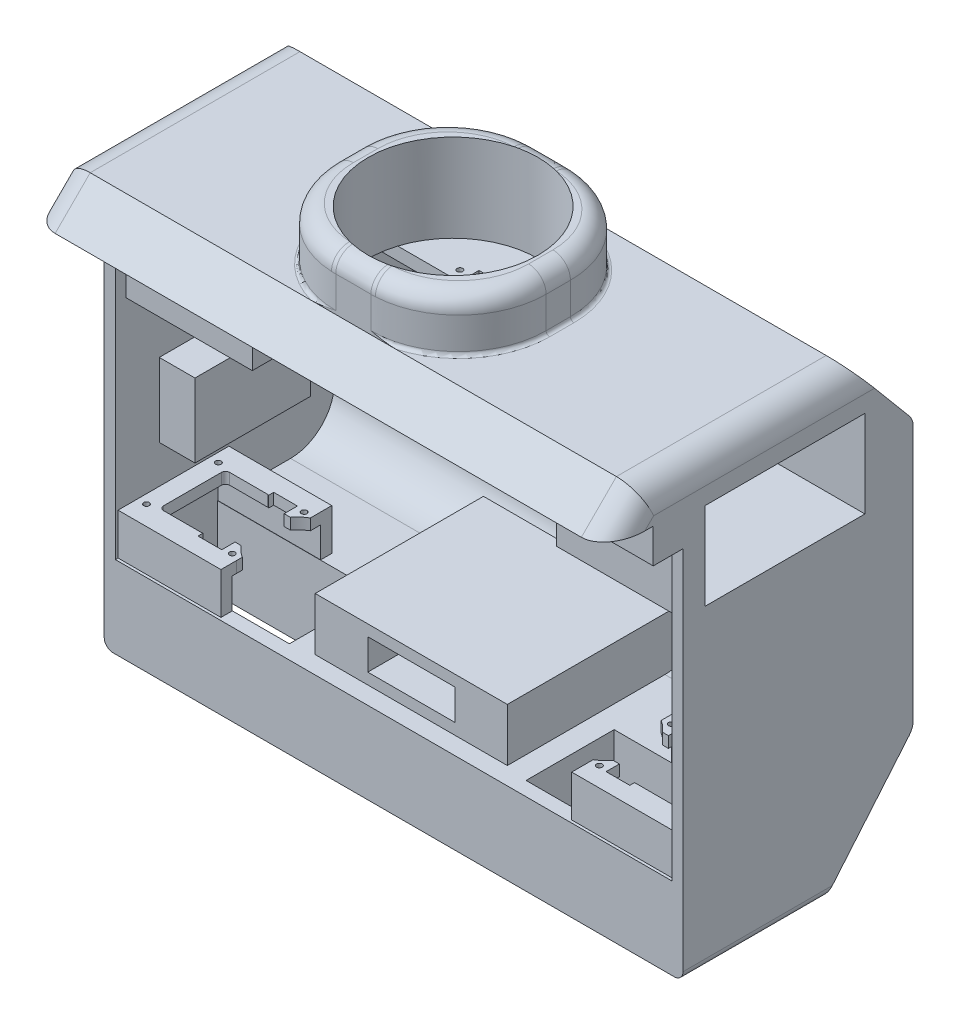
from build123d import *

# Parameters (mm, degrees)
SKETCH1_W               = 165.1
SKETCH1_H               = 54
BOSS_EXTRUDE1_DEPTH     = 6.35
BOSS_EXTRUDE2_DEPTH     = 165.1
SKETCH7_W               = 3.175
SKETCH7_H               = 90
BOSS_EXTRUDE3_DEPTH     = 62.482691454
BOSS_EXTRUDE4_DEPTH     = 1
CUT_EXTRUDE2_DEPTH      = 193.510277918
CUT_EXTRUDE2_DEPTH_BACK = 193.510277918
SKETCH10_W              = 60
SKETCH10_H              = 47.65
BOSS_EXTRUDE6_DEPTH     = 3.175
SKETCH15_W              = 45.62
SKETCH15_H              = 25.12
CUT_EXTRUDE3_DEPTH      = 10
SKETCH16_W              = 165.1
SKETCH16_H              = 65.657691454
SKETCH16_W_2            = 45.62
SKETCH16_H_2            = 25.12
BOSS_EXTRUDE7_DEPTH     = 17
CHAMFER2_SIZE           = 4
CHAMFER2_SIZE2          = 3.356398525
CHAMFER3_SIZE           = 30
CHAMFER3_SIZE2          = 25.172988935
FILLET1_R               = 12.5
FILLET2_R               = 5
CHAMFER5_SIZE           = 3.175
CHAMFER6_SIZE           = 3.175
BOSS_EXTRUDE9_DEPTH     = 20.535
BOSS_EXTRUDE10_REACH    = 145.635
CUT_EXTRUDE4_DEPTH      = 20
SKETCH25_R              = 24.2
SKETCH25_R_2            = 4.327955779
BOSS_EXTRUDE11_DEPTH    = 10
CHAMFER9_SIZE2          = 8.390996312
CHAMFER9_SIZE           = 10
SKETCH26_W              = 60
SKETCH26_H              = 56.936490272
SKETCH26_R              = 24.2
BOSS_EXTRUDE12_DEPTH    = 15
BOSS_EXTRUDE13_DEPTH    = 3.5
FILLET6_R               = 25
FILLET7_R               = 5
SKETCH28_W              = 35.968101279
SKETCH28_H              = 45.615895688
CUT_EXTRUDE5_DEPTH      = 7.5
SKETCH29_W              = 35.968101279
SKETCH29_H              = 45.615895688
CUT_EXTRUDE6_DEPTH      = 7.5
FILLET8_R               = 7.5
FILLET9_R               = 2.5
SKETCH31_W              = 5.585601369
SKETCH31_H              = 21.2
CUT_EXTRUDE7_DEPTH      = 10
SKETCH30_R              = 0.8
BOSS_EXTRUDE14_DEPTH    = 7.08
SKETCH33_W              = 12
SKETCH33_H              = 51.965895688
CUT_EXTRUDE9_DEPTH      = 7.5
CHAMFER12_SIZE          = 7.5
BOSS_EXTRUDE15_DEPTH    = 3.175
SKETCH37_W              = 32.793101279
SKETCH37_H              = 45.615895688
BOSS_EXTRUDE16_DEPTH    = 3.175
SKETCH42_R              = 0.8
CUT_EXTRUDE10_DEPTH     = 8
BOSS_EXTRUDE17_DEPTH    = 3.175
SKETCH41_W              = 29.34851345
SKETCH41_H              = 3.175
SKETCH41_W_2            = 29.348515031
BOSS_EXTRUDE19_DEPTH    = 8.65
SKETCH43_W              = 54.81
SKETCH43_H              = 44.952691454
SKETCH43_H_2            = 3.047308546
BOSS_EXTRUDE20_DEPTH    = 15.1
FILLET11_R              = 1
FILLET12_R              = 5
BOSS_EXTRUDE21_REACH    = 213.049
FILLET13_START          = 36
FILLET13_DEPTH          = 17
SKETCH45_W              = 24.81
SKETCH45_H              = 8.75
CUT_EXTRUDE11_DEPTH     = 48
SKETCH46_W              = 33.002691454
SKETCH46_H              = 21
BOSS_EXTRUDE22_DEPTH    = 10.18
SKETCH47_R              = 0.799606177
SKETCH47_R_2            = 0.796689263
BOSS_EXTRUDE24_DEPTH    = 3.7


with BuildPart() as part:
    # Sketch1 → Boss-Extrude1 (new body)
    with BuildSketch(Plane(origin=(0, 0, 0), x_dir=(1, 0, 0), z_dir=(0, 1, 0))):
        with Locations((0, 1.6)):
            Rectangle(SKETCH1_W, SKETCH1_H)
    extrude(amount=BOSS_EXTRUDE1_DEPTH)

    # Sketch6 → Boss-Extrude2 (add)
    with BuildSketch(Plane.ZY.offset(82.55)):
        Polygon((-37.082691454, 90), (-37.082691454, 6.35), (-28.6, 6.35), (-28.6, 0), (-40.257691454, 0), (-40.257691454, 90), align=None)
    extrude(amount=-BOSS_EXTRUDE2_DEPTH)

    # Sketch7 → Boss-Extrude3 (add)
    with BuildSketch(Plane.XY.offset(25.4)):
        with Locations((-80.9625, 45)):
            Rectangle(SKETCH7_W, SKETCH7_H)
        with Locations((80.9625, 45)):
            Rectangle(SKETCH7_W, SKETCH7_H)
    extrude(amount=-BOSS_EXTRUDE3_DEPTH)

    # Sketch9 → Boss-Extrude4 (add)
    with BuildSketch(Plane(origin=(0, 0, -40.257691454), x_dir=(-1, 0, 0), z_dir=(0, 0, -1))):
        with BuildLine():
            Line((-65.55, 83), (65.55, 83))
            ThreePointArc((65.55, 83), (66.964213562, 82.414213562), (67.55, 81))
            Line((67.55, 81), (67.55, 32))
            ThreePointArc((67.55, 32), (66.964213562, 30.585786438), (65.55, 30))
            Line((65.55, 30), (-65.55, 30))
            ThreePointArc((-65.55, 30), (-66.964213562, 30.585786438), (-67.55, 32))
            Line((-67.55, 32), (-67.55, 81))
            ThreePointArc((-67.55, 81), (-66.964213562, 82.414213562), (-65.55, 83))
        make_face()
    extrude(amount=BOSS_EXTRUDE4_DEPTH)

    # Sketch10 → Cut-Extrude2 (cut, two sides: drawn at the far end of the back side and taken through both)
    with BuildSketch(Plane.ZY.offset(82.55).offset(-CUT_EXTRUDE2_DEPTH_BACK)):
        with Locations((-4.6, 66.175)):
            Rectangle(SKETCH10_W, SKETCH10_H)
    extrude(amount=CUT_EXTRUDE2_DEPTH + CUT_EXTRUDE2_DEPTH_BACK, mode=Mode.SUBTRACT)

    # Sketch12 → Boss-Extrude6 (add)
    with BuildSketch(Plane(origin=(0, 90, 0), x_dir=(1, 0, 0), z_dir=(0, 1, 0))):
        Polygon((-82.55, -25.4), (-82.55, -30.4), (82.55, -30.4), (82.55, -25.4), (82.55, 40.257691454), (-82.55, 40.257691454), align=None)
    extrude(amount=BOSS_EXTRUDE6_DEPTH)

    # Sketch15 → Cut-Extrude3 (cut)
    with BuildSketch(Plane.XZ):
        with Locations((-56.565, 8.821154273)):
            Rectangle(SKETCH15_W, SKETCH15_H)
        with Locations((56.565, 8.821154273)):
            Rectangle(SKETCH15_W, SKETCH15_H)
    extrude(amount=-CUT_EXTRUDE3_DEPTH, mode=Mode.SUBTRACT)

    # Sketch16 → Boss-Extrude7 (add)
    with BuildSketch(Plane.XZ):
        with Locations((0, -7.428845727)):
            Rectangle(SKETCH16_W, SKETCH16_H)
        with Locations((-56.565, 8.821154273)):
            Rectangle(SKETCH16_W_2, SKETCH16_H_2, mode=Mode.SUBTRACT)
        with Locations((56.565, 8.821154273)):
            Rectangle(SKETCH16_W_2, SKETCH16_H_2, mode=Mode.SUBTRACT)
    extrude(amount=BOSS_EXTRUDE7_DEPTH)

    # Chamfer2
    chamfer2_edges = [part.edges().sort_by_distance(p)[0] for p in [
        (0, 93.175, -40.257691454),
    ]]
    chamfer2_side = [part.faces().sort_by_distance(p)[0] for p in [
        (0, 26.143741279, -40.257691454),
    ]]
    chamfer(chamfer2_edges, length=CHAMFER2_SIZE, length2=CHAMFER2_SIZE2, reference=chamfer2_side[0])

    # Chamfer3
    chamfer3_edges = [part.edges().sort_by_distance(p)[0] for p in [
        (0, -17, -40.257691454),
    ]]
    chamfer3_side = [part.faces().sort_by_distance(p)[0] for p in [
        (0, 22.003358437, -40.257691454),
    ]]
    chamfer(chamfer3_edges, length=CHAMFER3_SIZE, length2=CHAMFER3_SIZE2, reference=chamfer3_side[0])

    # Fillet1
    fillet1_edges = [part.edges().sort_by_distance(p)[0] for p in [
        (0, 6.35, -37.082691454),
    ]]
    fillet(fillet1_edges, radius=FILLET1_R)

    # Fillet2
    fillet2_edges = [part.edges().sort_by_distance(p)[0] for p in [
        (0, 13, -40.257691454),
    ]]
    fillet(fillet2_edges, radius=FILLET2_R)

    # Chamfer5
    chamfer5_edges = [part.edges().sort_by_distance(p)[0] for p in [
        (-80.9625, 90, -34.6),
        (80.9625, 90, -34.6),
    ]]
    chamfer(chamfer5_edges, length=CHAMFER5_SIZE)

    # Chamfer6
    chamfer6_edges = [part.edges().sort_by_distance(p)[0] for p in [
        (-80.9625, 42.35, -34.6),
        (80.9625, 42.35, -34.6),
    ]]
    chamfer(chamfer6_edges, length=CHAMFER6_SIZE)

    # Sketch18 → Boss-Extrude9 (add)
    with BuildSketch(Plane(origin=(0, 93.175, 0), x_dir=(1, 0, 0), z_dir=(0, 1, 0))):
        Polygon((-46.581898721, -19.129674968), (-82.55, -19.129674968), (-82.55, -22.304674968), (-43.406898721, -22.304674968), (-43.406898721, 29.66122072), (-82.55, 29.66122072), (-82.55, 26.48622072), (-46.581898721, 26.48622072), align=None)
    boss_extrude9 = extrude(amount=-BOSS_EXTRUDE9_DEPTH)

    # Mirror1: Boss-Extrude9 across plane
    add(boss_extrude9.mirror(Plane(origin=(0, 0, 0), x_dir=(0, 0, 1), z_dir=(1, 0, 0))))

    # Boss-Extrude10: up to this plane
    boss_extrude10_end = Plane(origin=(0, 93.175, -36.901292929), z_dir=(0, 0.642787609686539, -0.7660444431189783))
    # Sketch20 → Boss-Extrude10 (add, up to the surface)
    with BuildSketch(Plane.XY.offset(30.4), mode=Mode.PRIVATE) as boss_extrude10_sk1:
        Polygon((-52.55, 99.825839879), (52.55, 99.825839879), (82.55, 99.825839879), (82.55, 93.175), (-82.55, 93.175), (-82.55, 99.825839879), align=None)
    boss_extrude10_tool1 = split(extrude(boss_extrude10_sk1.sketch, amount=-BOSS_EXTRUDE10_REACH, mode=Mode.PRIVATE), bisect_by=boss_extrude10_end, keep=Keep.BOTH, mode=Mode.PRIVATE)
    add(boss_extrude10_tool1.solids().sort_by_distance((0, 96.50042, 30.4))[0])

    # Sketch23 → Cut-Extrude4 (cut)
    with BuildSketch(Plane(origin=(0, 99.825839879, 0), x_dir=(1, 0, 0), z_dir=(0, 1, 0))):
        with BuildLine():
            Line((8.384417448, -20.561333056), (9.877394556, -19.068355948))
            ThreePointArc((9.877394556, -19.068355948), (10.188277859, -18.689544742), (10.419285151, -18.257361923))
            ThreePointArc((10.419285151, -18.257361923), (10.561538197, -17.788414636), (10.609570503, -17.300725817))
            Line((10.609570503, -17.300725817), (10.609570503, 0.433707386))
            ThreePointArc((10.609570503, 0.433707386), (10.561538223, 0.921395053), (10.419285642, 1.39034128))
            ThreePointArc((10.419285642, 1.39034128), (10.188277932, 1.822525176), (9.877393834, 2.201337214))
            Line((9.877393834, 2.201337214), (8.384416723, 3.694314325))
            ThreePointArc((8.384416723, 3.694314325), (8.005605517, 4.005197628), (7.573422697, 4.23620492))
            ThreePointArc((7.573422697, 4.23620492), (7.104475411, 4.378457966), (6.616786591, 4.426490271))
            Line((6.616786591, 4.426490271), (-33.110604264, 4.426490271))
            ThreePointArc((-33.110604264, 4.426490271), (-34.87827006, 3.694345107), (-35.610429497, 1.926685224))
            Line((-35.610429497, 1.926685224), (-35.610429497, -18.793692999))
            ThreePointArc((-35.610429497, -18.793692999), (-35.420160735, -19.750343242), (-34.878277155, -20.561357469))
            ThreePointArc((-34.878277155, -20.561357469), (-34.067268353, -21.103238753), (-33.110624449, -21.293509728))
            Line((-33.110624449, -21.293509728), (6.616786596, -21.293509728))
            ThreePointArc((6.616786596, -21.293509728), (7.104474783, -21.245477548), (7.573421511, -21.103224868))
            ThreePointArc((7.573421511, -21.103224868), (8.005605409, -20.872217156), (8.384417448, -20.561333056))
        make_face()
    extrude(amount=-CUT_EXTRUDE4_DEPTH, mode=Mode.SUBTRACT)

    # Sketch25 → Boss-Extrude11 (add)
    # profile 1 of 2: a face of its own
    with BuildSketch(Plane(origin=(0, 99.825839879, 0), x_dir=(1, 0, 0), z_dir=(0, 1, 0))):
        Polygon((-82.55, -30.4), (-82.55, 31.320575639), (82.55, 31.320575639), (82.55, -30.4), (82.55, -36.9), (-82.55, -36.9), align=None)
        with Locations(Location((-0.000429497, -8.433509728, 0), (0, 0, 147.89956854))):
            Circle(SKETCH25_R, mode=Mode.SUBTRACT)
    # profile 2 of 2: a face of its own
    with BuildSketch(Plane(origin=(0, 99.825839879, 0), x_dir=(1, 0, 0), z_dir=(0, 1, 0))):
        with Locations((-0.000429497, -8.433509728)):
            Circle(SKETCH25_R_2)
    extrude(amount=BOSS_EXTRUDE11_DEPTH)


with BuildPart() as boss_extrude11_kept_piece:
    # of the separate pieces the step leaves, the one the design keeps (boss_extrude11_pieces_kept)
    add(part.part.solids().sort_by_distance((-82.55, 45.525, -34.6))[0])

    # Chamfer9
    chamfer9_edges = [boss_extrude11_kept_piece.edges().sort_by_distance(p)[0] for p in [
        (0, 109.825839879, -31.320575639),
    ]]
    chamfer9_side = [boss_extrude11_kept_piece.faces().sort_by_distance(p)[0] for p in [
        (0, 109.658019953, -31.320575639),
    ]]
    chamfer(chamfer9_edges, length=CHAMFER9_SIZE - 0.0001, length2=CHAMFER9_SIZE2 - 0.0001, reference=chamfer9_side[0])  # a hair under: the kernel refuses the full size

    # Sketch26 → Boss-Extrude12 (add)
    with BuildSketch(Plane(origin=(0, 109.825839879, 0), x_dir=(1, 0, 0), z_dir=(0, 1, 0))):
        with Locations((-0.000429497, -8.431754864)):
            Rectangle(SKETCH26_W, SKETCH26_H)
        with Locations(Location((-0.000429497, -8.433509728, 0), (0, 0, 147.89956854))):
            Circle(SKETCH26_R, mode=Mode.SUBTRACT)
    extrude(amount=BOSS_EXTRUDE12_DEPTH)

    # Sketch27 → Boss-Extrude13 (add)
    with BuildSketch(Plane.XY.offset(30.4)):
        Polygon((82.55, 90), (82.55, 99.825839879), (10.154042678, 99.825839879), (-10.154901672, 99.825839879), (-82.55, 99.825839879), (-82.55, 90), align=None)
    extrude(amount=BOSS_EXTRUDE13_DEPTH)

    # Fillet6
    fillet6_edges = [boss_extrude11_kept_piece.edges().sort_by_distance(p)[0] for p in [
        (-30.000429497, 117.325839879, 36.9),
        (29.999570503, 117.325839879, 36.9),
        (29.999570503, 117.325839879, -20.036490272),
        (-30.000429497, 117.325839879, -20.036490272),
    ]]
    fillet(fillet6_edges, radius=FILLET6_R)

    # Fillet7
    fillet7_edges = [boss_extrude11_kept_piece.edges().sort_by_distance(p)[0] for p in [
        (22.677240033, 124.825839879, -12.714159801),
        (29.999570503, 124.825839879, 8.431754864),
        (22.677240033, 124.825839879, 29.57766953),
        (-22.678099027, 124.825839879, 29.57766953),
        (-30.000429497, 124.825839879, 8.431754864),
        (-22.678099027, 124.825839879, -12.714159801),
    ]]
    fillet(fillet7_edges, radius=FILLET7_R)

    # Sketch28 → Cut-Extrude5 (cut)
    with BuildSketch(Plane.XZ.offset(-90)):
        with Locations((64.565949361, -3.678272876)):
            Rectangle(SKETCH28_W, SKETCH28_H)
    extrude(amount=-CUT_EXTRUDE5_DEPTH, mode=Mode.SUBTRACT)

    # Sketch29 → Cut-Extrude6 (cut)
    with BuildSketch(Plane.XZ.offset(-90)):
        with Locations((-64.565949361, -3.678272876)):
            Rectangle(SKETCH29_W, SKETCH29_H)
    extrude(amount=-CUT_EXTRUDE6_DEPTH, mode=Mode.SUBTRACT)

    # Fillet8
    fillet8_edges = [boss_extrude11_kept_piece.edges().sort_by_distance(p)[0] for p in [
        (82.55, 109.825839879, 6.985160336),
        (-82.55, 109.825839879, 6.985160336),
    ]]
    fillet(fillet8_edges, radius=FILLET8_R)

    # Fillet9
    fillet9_edges = [boss_extrude11_kept_piece.edges().sort_by_distance(p)[0] for p in [
        (-82.55, -17, 5.157648741),
        (82.55, -17, 5.157648741),
    ]]
    fillet(fillet9_edges, radius=FILLET9_R)

    # Sketch31 → Cut-Extrude7 (cut)
    with BuildSketch(Plane(origin=(-43.406898721, 0, 0), x_dir=(0, 0, -1), z_dir=(1, 0, 0))):
        with Locations((5.166969313, 85.04)):
            Rectangle(SKETCH31_W, SKETCH31_H)
    cut_extrude7 = extrude(amount=-CUT_EXTRUDE7_DEPTH, mode=Mode.SUBTRACT)

    # Sketch30 → Boss-Extrude14 (add)
    with BuildSketch(Plane(origin=(-43.406898721, 0, 0), x_dir=(0, 0, -1), z_dir=(1, 0, 0))):
        Polygon((-3.358535112, 96.400005376), (-3.358535112, 95.107314564), (2.374168628, 91.540005378), (2.374168628, 95.64), (7.959769997, 95.64), (8.504985928, 94.564765777), (21.838059268, 94.564765777), (21.838059268, 75.489463978), (8.504985928, 75.489463978), (7.959769997, 74.44), (2.374168628, 74.44), (2.374168628, 78.540005378), (-3.358530552, 74.972690815), (-3.358530552, 73.679999994), (-2.358530552, 72.679998788), (24.290180845, 72.679972485), (26.290012732, 74.679801961), (26.286225253, 95.206411236), (24.180057422, 97.400004065), (-2.358535217, 97.400004065), align=None)
        with Locations((-0.520014072, 95.29)):
            Circle(SKETCH30_R, mode=Mode.SUBTRACT)
        with Locations((23.929985928, 95.29)):
            Circle(SKETCH30_R, mode=Mode.SUBTRACT)
        with Locations((23.929985928, 74.79)):
            Circle(SKETCH30_R, mode=Mode.SUBTRACT)
        with Locations((-0.520014072, 74.79)):
            Circle(SKETCH30_R, mode=Mode.SUBTRACT)
    boss_extrude14 = extrude(amount=-BOSS_EXTRUDE14_DEPTH)

    # Sketch33 → Cut-Extrude9 (cut)
    with BuildSketch(Plane.XZ.offset(-90)):
        with Locations((-37.406898721, -3.678272876)):
            Rectangle(SKETCH33_W, SKETCH33_H)
        with Locations((37.406898721, -3.678272876)):
            Rectangle(SKETCH33_W, SKETCH33_H)
    extrude(amount=-CUT_EXTRUDE9_DEPTH, mode=Mode.SUBTRACT)

    # Chamfer12
    chamfer12_edges = [boss_extrude11_kept_piece.edges().sort_by_distance(p)[0] for p in [
        (-31.406898721, 90, 21.799092348),
        (-31.406898721, 90, -17.043855495),
        (31.406898721, 90, -3.678272876),
    ]]
    chamfer(chamfer12_edges, length=CHAMFER12_SIZE - 0.0001)  # a hair under: the kernel refuses the full size

    # Mirror2: Cut-Extrude7, Boss-Extrude14 across plane
    add(cut_extrude7.mirror(Plane(origin=(0, 0, 0), x_dir=(0, 0, 1), z_dir=(1, 0, 0))), mode=Mode.SUBTRACT)
    add(boss_extrude14.mirror(Plane(origin=(0, 0, 0), x_dir=(0, 0, 1), z_dir=(1, 0, 0))))

    # Sketch36 → Boss-Extrude15 (add)
    with BuildSketch(Plane.ZY.offset(82.55)):
        Polygon((-29.66122072, 72.64), (-29.66122072, 90), (-31.425, 90), (-34.6, 86.825), (-34.6, 45.525), (-31.425, 42.35), (25.4, 42.35), (25.4, 90), (22.304674968, 90), (22.304674968, 72.64), align=None)
    boss_extrude15 = extrude(amount=-BOSS_EXTRUDE15_DEPTH)

    # Sketch37 → Boss-Extrude16 (add)
    with BuildSketch(Plane.XZ.offset(-72.64)):
        with Locations((-62.978449361, -3.678272876)):
            Rectangle(SKETCH37_W, SKETCH37_H)
        Polygon((-43.406898721, -29.66122072), (-43.406898721, 22.304674968), (-79.375, 22.304674968), (-79.375, 19.129674968), (-46.581898721, 19.129674968), (-46.581898721, -26.48622072), (-79.375, -26.48622072), (-79.375, -29.66122072), align=None)
    boss_extrude16 = extrude(amount=BOSS_EXTRUDE16_DEPTH)

    # Sketch42 → Cut-Extrude10 (cut)
    with BuildSketch(Plane.ZY.offset(50.486898721)):
        with Locations(Location((-23.929985928, 74.79, 0), (0, 0, 180))):
            Circle(SKETCH42_R)
        with Locations(Location((0.520014072, 74.79, 0), (0, 0, 180))):
            Circle(SKETCH42_R)
        with Locations(Location((0.520014072, 95.29, 0), (0, 0, 180))):
            Circle(SKETCH42_R)
        with Locations(Location((-23.929985928, 95.29, 0), (0, 0, 180))):
            Circle(SKETCH42_R)
    cut_extrude10 = extrude(amount=-CUT_EXTRUDE10_DEPTH, mode=Mode.SUBTRACT)

    # Mirror3: Boss-Extrude15, Boss-Extrude16, Cut-Extrude10 across plane
    add(boss_extrude15.mirror(Plane(origin=(0, 0, 0), x_dir=(0, 0, 1), z_dir=(1, 0, 0))))
    add(boss_extrude16.mirror(Plane(origin=(0, 0, 0), x_dir=(0, 0, 1), z_dir=(1, 0, 0))))
    add(cut_extrude10.mirror(Plane(origin=(0, 0, 0), x_dir=(0, 0, 1), z_dir=(1, 0, 0))), mode=Mode.SUBTRACT)

    # Sketch39 → Boss-Extrude17 (add)
    with BuildSketch(Plane(origin=(0, 15, 0), x_dir=(1, 0, 0), z_dir=(0, 1, 0))):
        with BuildLine():
            Line((-50.026484969, 2.538834251), (-50.026484969, 6.985329662))
            Line((-50.026484969, 6.985329662), (-82.55, 6.985329662))
            Line((-82.55, 6.985329662), (-82.55, 3.038878455))
            Line((-82.55, 3.038878455), (-82.55, -20.681183224))
            Line((-82.55, -20.681183224), (-82.55, -24.62763407))
            Line((-82.55, -24.62763407), (-50.02648655, -24.62763407))
            Line((-50.02648655, -24.62763407), (-50.02648655, -20.181146472))
            Line((-50.02648655, -20.181146472), (-50.026483181, -18.52763407))
            ThreePointArc((-50.026483181, -18.52763407), (-51.660455267, -17.310211409), (-53.051383222, -15.821150585))
            Line((-53.051383222, -15.821150585), (-54.814999932, -15.82115373))
            Line((-54.814999932, -15.82115373), (-54.815000004, -19.621154273))
            Line((-54.815000004, -19.621154273), (-61.59, -19.621154273))
            Line((-61.59, -19.621154273), (-61.59, -18.124197186))
            Line((-61.59, -18.124197186), (-61.812898808, -18.263440967))
            Line((-61.812898808, -18.263440967), (-72.768085322, -18.263440967))
            ThreePointArc((-72.768085322, -18.263440967), (-73.616613459, -17.911969105), (-73.968085322, -17.063440969))
            Line((-73.968085322, -17.063440969), (-73.968085322, -0.578867579))
            ThreePointArc((-73.968085322, -0.578867579), (-73.616613461, 0.269660557), (-72.768085326, 0.621132421))
            Line((-72.768085326, 0.621132421), (-61.812898808, 0.621132421))
            Line((-61.812898808, 0.621132421), (-61.59, 0.48188864))
            Line((-61.59, 0.48188864), (-61.59, 1.978845727))
            Line((-61.59, 1.978845727), (-54.815000004, 1.978845727))
            Line((-54.815000004, 1.978845727), (-54.814999932, -1.821154814))
            Line((-54.814999932, -1.821154814), (-53.051385765, -1.821157945))
            ThreePointArc((-53.051385765, -1.821157945), (-51.660455467, -0.33209461), (-50.026480298, 0.885329662))
            Line((-50.026480298, 0.885329662), (-50.026484969, 2.538834251))
        make_face()
        with BuildLine():
            ThreePointArc((-53.165, -19.071154273), (-52.365023362, -19.87113429), (-51.565039966, -19.071161031))
            ThreePointArc((-51.565039966, -19.071161031), (-52.365016604, -18.271174256), (-53.165, -19.071154273))
        make_face(mode=Mode.SUBTRACT)
        with BuildLine():
            ThreePointArc((-51.565039964, 1.42883958), (-52.365016909, 2.228825745), (-53.165, 1.428845727))
            ThreePointArc((-53.165, 1.428845727), (-52.365023056, 0.628865709), (-51.565039964, 1.42883958))
        make_face(mode=Mode.SUBTRACT)
        with BuildLine():
            ThreePointArc((-76.015039964, -19.07116042), (-76.815016909, -18.271174255), (-77.615, -19.071154273))
            ThreePointArc((-77.615, -19.071154273), (-76.815023056, -19.871134291), (-76.015039964, -19.07116042))
        make_face(mode=Mode.SUBTRACT)
        with BuildLine():
            ThreePointArc((-76.015039964, 1.42883958), (-76.815016909, 2.228825745), (-77.615, 1.428845727))
            ThreePointArc((-77.615, 1.428845727), (-76.815023056, 0.628865709), (-76.015039964, 1.42883958))
        make_face(mode=Mode.SUBTRACT)
    boss_extrude17 = extrude(amount=BOSS_EXTRUDE17_DEPTH)

    # Sketch41 → Boss-Extrude19 (add)
    with BuildSketch(Plane.XZ.offset(-15)):
        with Locations((-64.700743275, 23.04013407)):
            Rectangle(SKETCH41_W, SKETCH41_H)
        with Locations((-64.700742484, -5.397829662)):
            Rectangle(SKETCH41_W_2, SKETCH41_H)
    boss_extrude19 = extrude(amount=BOSS_EXTRUDE19_DEPTH)

    # Mirror4: Boss-Extrude17, Boss-Extrude19 across plane
    add(boss_extrude17.mirror(Plane(origin=(0, 0, 0), x_dir=(0, 0, 1), z_dir=(1, 0, 0))))
    add(boss_extrude19.mirror(Plane(origin=(0, 0, 0), x_dir=(0, 0, 1), z_dir=(1, 0, 0))))

    # Sketch43 → Boss-Extrude20 (add)
    with BuildSketch(Plane(origin=(0, 6.35, 0), x_dir=(1, 0, 0), z_dir=(0, 1, 0))):
        with Locations((0, 2.106345727)):
            Rectangle(SKETCH43_W, SKETCH43_H)
        with Locations((0, 26.106345727)):
            Rectangle(SKETCH43_W, SKETCH43_H_2)
    extrude(amount=BOSS_EXTRUDE20_DEPTH)

    # Fillet11
    # the kernel refuses this fillet: 1 mm, written as the material it adds along each edge
    with BuildSketch(Plane(origin=(-30.000429497, 109.825839879, 11.9), x_dir=(-1, 0, 0), z_dir=(0, 0, -1)), Plane(origin=(29.999570503, 109.825839879, 4.963509728), x_dir=(1, 0, 0), z_dir=(0, 0, 1))) as fillet11_piece_1:
        with BuildLine():
            CenterArc((FILLET11_R, FILLET11_R), FILLET11_R, 180, 90)
            Line((0, FILLET11_R), (0, 0))
            Line((0, 0), (FILLET11_R, 0))
        make_face()
    extrude(amount=6.936490272)
    with BuildSketch(Plane(origin=(-5.000429497, 109.825839879, -20.036490272), x_dir=(0, 0, -1), z_dir=(1, 0, 0))) as fillet11_piece_2:
        with BuildLine():
            CenterArc((FILLET11_R, FILLET11_R), FILLET11_R, 180, 90)
            Line((0, FILLET11_R), (0, 0))
            Line((0, 0), (FILLET11_R, 0))
        make_face()
    extrude(amount=10)
    with BuildSketch(Plane(origin=(-5.000429497, 109.825839879, 4.963509728), x_dir=(0, 0, -1), z_dir=(1, 0, 0))) as fillet11_piece_3:
        with BuildLine():
            CenterArc((25 + FILLET11_R, FILLET11_R), FILLET11_R, 180, 90)
            Line((25, FILLET11_R), (25, 0))
            Line((25, 0), (25 + FILLET11_R, 0))
        make_face()
    revolve(axis=Axis((-5.000429497, 109.825839879, 4.963509728), (0, 1, 0)), revolution_arc=90)
    with BuildSketch(Plane(origin=(4.999570503, 109.825839879, 4.963509728), x_dir=(1, 0, 0), z_dir=(0, 0, 1))) as fillet11_piece_4:
        with BuildLine():
            CenterArc((25 + FILLET11_R, FILLET11_R), FILLET11_R, 180, 90)
            Line((25, FILLET11_R), (25, 0))
            Line((25, 0), (25 + FILLET11_R, 0))
        make_face()
    revolve(axis=Axis((4.999570503, 109.825839879, 4.963509728), (0, 1, 0)), revolution_arc=90)
    with BuildSketch(Plane(origin=(-5.000429497, 109.825839879, 11.9), x_dir=(-1, 0, 0), z_dir=(0, 0, -1))) as fillet11_piece_5_section:
        with BuildLine():
            CenterArc((25 + FILLET11_R, FILLET11_R), FILLET11_R, 180, 90)
            Line((25, FILLET11_R), (25, 0))
            Line((25, 0), (25 + FILLET11_R, 0))
        make_face()
    fillet11_piece_5 = revolve(axis=Axis((-5.000429497, 109.825839879, 11.9), (0, 1, 0)), revolution_arc=107.195638708, mode=Mode.PRIVATE)
    fillet11_piece_5 = split(fillet11_piece_5, bisect_by=Plane(origin=(-5.000429497, 109.825839879, 36.9), z_dir=(0, 0, -1)), keep=Keep.TOP, mode=Mode.PRIVATE)
    add(fillet11_piece_5)
    with BuildSketch(Plane(origin=(4.999570503, 109.825839879, 11.9), x_dir=(1, 0, 0), z_dir=(0, 0, -1))) as fillet11_piece_6_section:
        with BuildLine():
            CenterArc((25 + FILLET11_R, -FILLET11_R), FILLET11_R, 90, 90)
            Line((25, -FILLET11_R), (25, 0))
            Line((25, 0), (25 + FILLET11_R, 0))
        make_face()
    fillet11_piece_6 = revolve(axis=Axis((4.999570503, 109.825839879, 11.9), (0, -1, 0)), revolution_arc=107.195638708, mode=Mode.PRIVATE)
    fillet11_piece_6 = split(fillet11_piece_6, bisect_by=Plane(origin=(4.999570503, 109.825839879, 36.9), z_dir=(0, 0, -1)), keep=Keep.TOP, mode=Mode.PRIVATE)
    add(fillet11_piece_6)

    # Fillet12
    fillet12_edges = [boss_extrude11_kept_piece.edges().sort_by_distance(p)[0] for p in [
        (0, 89.175, -40.257691454),
    ]]
    fillet(fillet12_edges, radius=FILLET12_R)

    # Boss-Extrude21: up to this face of the body (flat: up to its plane)
    boss_extrude21_end = Plane(boss_extrude11_kept_piece.part.faces().sort_by_distance((82.55, 39.267768435, -5.820106371))[0])
    # Sketch44 → Boss-Extrude21 (add, up to the picked face)
    with BuildSketch(Plane.ZY.offset(82.55), mode=Mode.PRIVATE) as boss_extrude21_sk1:
        Polygon((36.9, 102.325839879), (36.9, 109.825839879), (46.9, 99.825839879), (36.9, 99.825839879), align=None)
    boss_extrude21_tool1 = split(extrude(boss_extrude21_sk1.sketch, amount=-BOSS_EXTRUDE21_REACH, mode=Mode.PRIVATE), bisect_by=boss_extrude21_end, keep=Keep.BOTH, mode=Mode.PRIVATE)
    add(boss_extrude21_tool1.solids().sort_by(Axis((-82.55, 103.159173, 40.233333), (1, 0, 0)))[0])

    # Fillet13: read off the stored shape, not the designer's step
    # Fillet13 outline → Fillet13 (cut)
    with BuildSketch(Plane(origin=(0, 0, 0), x_dir=(1, 0, 0), z_dir=(0, 0.707106781186544, -0.707106781186551)).offset(FILLET13_START)):
        with BuildLine():
            Line((-82.55, -103.750836354), (-75.05, -103.750836354))
            ThreePointArc((-75.05, -103.750836354), (-80.353300859, -101.554137213), (-82.55, -96.250836354))
            Line((-82.55, -96.250836354), (-82.55, -103.750836354))
        make_face()
        with BuildLine():
            ThreePointArc((82.55, -96.250836354), (80.353300859, -101.554137213), (75.05, -103.750836354))
            Line((75.05, -103.750836354), (82.55, -103.750836354))
            Line((82.55, -103.750836354), (82.55, -96.250836354))
        make_face()
    extrude(amount=FILLET13_DEPTH, mode=Mode.SUBTRACT)

    # Sketch45 → Cut-Extrude11 (cut)
    with BuildSketch(Plane.XY.offset(20.37)):
        with Locations((0, 13.9)):
            Rectangle(SKETCH45_W, SKETCH45_H)
    extrude(amount=-CUT_EXTRUDE11_DEPTH, mode=Mode.SUBTRACT)

    # Sketch46 → Boss-Extrude22 (add)
    with BuildSketch(Plane.ZY.offset(-79.375)):
        with Locations((-3.631345727, 39.53)):
            Rectangle(SKETCH46_W, SKETCH46_H)
    boss_extrude22 = extrude(amount=BOSS_EXTRUDE22_DEPTH)

    # Mirror5: Boss-Extrude22 across plane
    add(boss_extrude22.mirror(Plane(origin=(0, 0, 0), x_dir=(0, 0, 1), z_dir=(1, 0, 0))))

    # Sketch47 → Boss-Extrude24 (add)
    # profile 1 of 2: a face of its own
    with BuildSketch(Plane(origin=(0, 99.825839879, 0), x_dir=(1, 0, 0), z_dir=(0, 1, 0))):
        with BuildLine():
            Line((-5.461913016, 1.124087247), (-5.461913016, 4.426490271))
            Line((-5.461913016, 4.426490271), (-20.500683154, 4.426490271))
            Line((-20.500683154, 4.426490271), (-33.110604264, 4.426490271))
            ThreePointArc((-33.110604264, 4.426490271), (-34.87827006, 3.694345107), (-35.610429497, 1.926685224))
            Line((-35.610429497, 1.926685224), (-35.610429497, -1.150873399))
            Line((-35.610429497, -1.150873399), (-23.078627175, -1.150873399))
            Line((-23.078627175, -1.150873399), (-8.300429497, -1.150873399))
            ThreePointArc((-8.300429497, -1.150873399), (-6.976364231, 0.105381211), (-5.461913016, 1.124087247))
        make_face()
        with Locations(Location((-8.300429497, 1.816490272, 0), (0, 0, 270))):
            Circle(SKETCH47_R, mode=Mode.SUBTRACT)
        with BuildLine():
            ThreePointArc((-29.800429497, 1.816490272), (-29.000429497, 1.016490272), (-28.200429497, 1.816490272))
            ThreePointArc((-28.200429497, 1.816490272), (-28.2188818, 1.987321176), (-28.273387491, 2.15027152))
            ThreePointArc((-28.273387491, 2.15027152), (-29.000429497, 2.616490272), (-29.727471503, 2.15027152))
            ThreePointArc((-29.727471503, 2.15027152), (-29.781977194, 1.987321176), (-29.800429497, 1.816490272))
        make_face(mode=Mode.SUBTRACT)
    # profile 2 of 2: a face of its own
    with BuildSketch(Plane(origin=(0, 99.825839879, 0), x_dir=(1, 0, 0), z_dir=(0, 1, 0))):
        with BuildLine():
            Line((-20.500683154, -21.293509728), (-5.461913016, -21.293510818))
            Line((-5.461913016, -21.293510818), (-5.461913016, -17.991106052))
            ThreePointArc((-5.461913016, -17.991106052), (-6.976364231, -16.972400016), (-8.300429497, -15.716145406))
            Line((-8.300429497, -15.716145406), (-23.078627381, -15.716145406))
            Line((-23.078627381, -15.716145406), (-35.610429497, -15.716145406))
            Line((-35.610429497, -15.716145406), (-35.610429497, -18.793692999))
            ThreePointArc((-35.610429497, -18.793692999), (-35.420160735, -19.750343242), (-34.878277155, -20.561357469))
            ThreePointArc((-34.878277155, -20.561357469), (-34.067268353, -21.103238753), (-33.110624449, -21.293509728))
            Line((-33.110624449, -21.293509728), (-20.500683154, -21.293509728))
        make_face()
        with Locations(Location((-8.300429497, -18.683509728, 0), (0, 0, 270))):
            Circle(SKETCH47_R_2, mode=Mode.SUBTRACT)
        with BuildLine():
            ThreePointArc((-29.800389531, -18.68350297), (-29.171243719, -19.465040617), (-28.273387491, -19.017290977))
            ThreePointArc((-28.273387491, -19.017290977), (-28.2188818, -18.854340632), (-28.200429497, -18.683509728))
            ThreePointArc((-28.200429497, -18.683509728), (-29.000406135, -17.883529711), (-29.800389531, -18.68350297))
        make_face(mode=Mode.SUBTRACT)
    extrude(amount=-BOSS_EXTRUDE24_DEPTH)


solid = boss_extrude11_kept_piece.part
